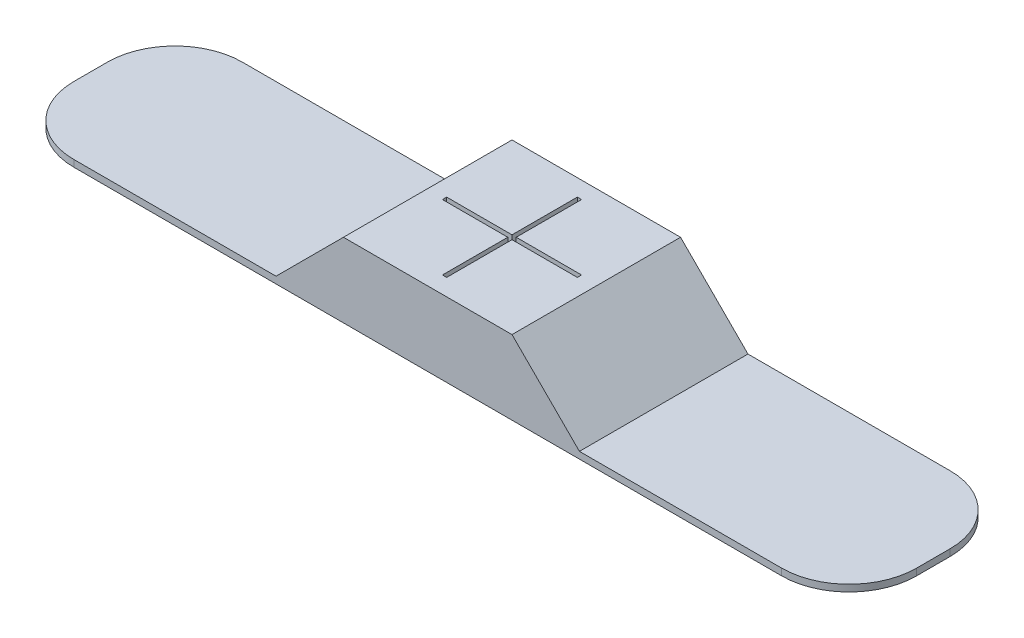
from build123d import *

# Parameters (mm, degrees)
SKETCH1_W           = 63.5
SKETCH1_H           = 63.5
BOSS_EXTRUDE1_DEPTH = 25.4
SKETCH1_3_W         = 63.5
SKETCH1_3_H         = 63.5
BOSS_EXTRUDE2_DEPTH = 2.54
SKETCH1_4_W         = 127
SKETCH1_4_H         = 63.5
BOSS_EXTRUDE3_DEPTH = 2.54
CHAMFER2_SIZE       = 25.4
FILLET1_R           = 25.4


with BuildPart() as part:
    # Sketch1 → Boss-Extrude1 (new body)
    with BuildSketch(Plane(origin=(0, 0, 0), x_dir=(1, 0, 0), z_dir=(0, 1, 0))):
        Rectangle(SKETCH1_W, SKETCH1_H)
        Polygon((-0.79375, 25.4), (-0.79375, 0.79375), (-25.4, 0.79375), (-25.4, -0.79375), (-0.79375, -0.79375), (-0.79375, -25.4), (0.79375, -25.4), (0.79375, -0.79375), (25.4, -0.79375), (25.4, 0.79375), (0.79375, 0.79375), (0.79375, 25.4), align=None, mode=Mode.SUBTRACT)
    extrude(amount=BOSS_EXTRUDE1_DEPTH)

    # Sketch1<3> → Boss-Extrude2 (add)
    with BuildSketch(Plane(origin=(0, 0, 0), x_dir=(1, 0, 0), z_dir=(0, 1, 0))):
        Rectangle(SKETCH1_3_W, SKETCH1_3_H)
    extrude(amount=-BOSS_EXTRUDE2_DEPTH)

    # Sketch1<4> → Boss-Extrude3 (add)
    with BuildSketch(Plane(origin=(0, 0, 0), x_dir=(1, 0, 0), z_dir=(0, 1, 0))):
        with Locations((95.25, 0)):
            Rectangle(SKETCH1_4_W, SKETCH1_4_H)
        with Locations((-95.25, 0)):
            Rectangle(SKETCH1_4_W, SKETCH1_4_H)
    extrude(amount=-BOSS_EXTRUDE3_DEPTH)

    # Chamfer2
    chamfer2_edges = [part.edges().sort_by_distance(p)[0] for p in [
        (31.75, 0, 0),
        (-31.75, 0, 0),
    ]]
    chamfer(chamfer2_edges, length=CHAMFER2_SIZE - 0.0001)  # a hair under: the kernel refuses the full size

    # Fillet1
    fillet1_edges = [part.edges().sort_by_distance(p)[0] for p in [
        (158.75, -1.27, -31.75),
        (158.75, -1.27, 31.75),
        (-158.75, -1.27, -31.75),
        (-158.75, -1.27, 31.75),
    ]]
    fillet(fillet1_edges, radius=FILLET1_R)


solid = part.part
